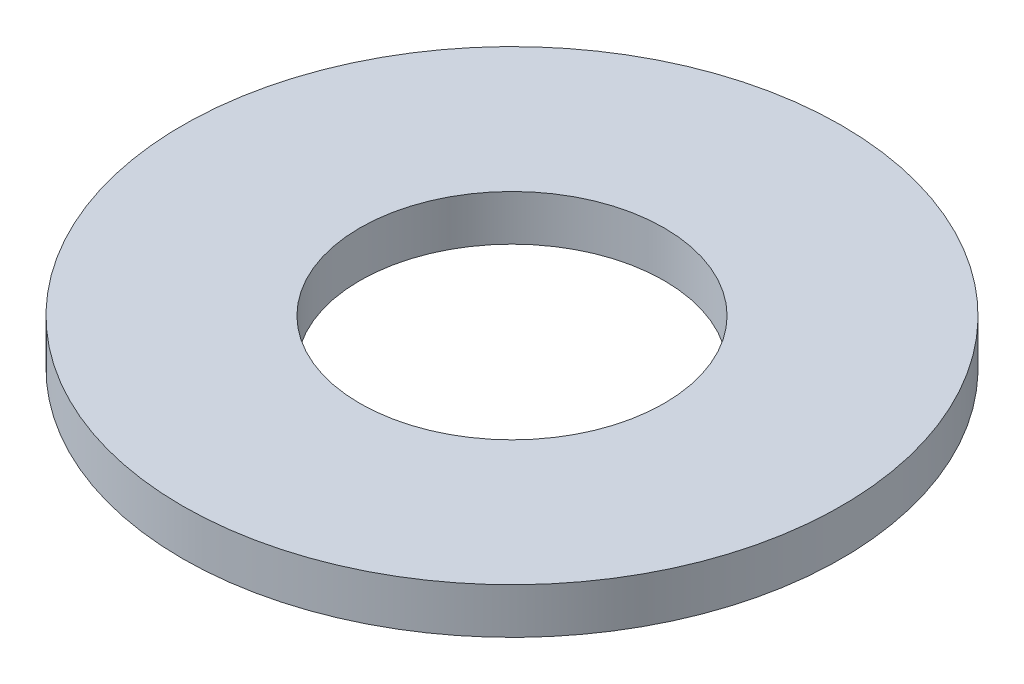
from build123d import *

# Parameters (mm, degrees)
SKETCH1_R           = 65
BOSS_EXTRUDE1_DEPTH = 9
SKETCH2_R           = 30
CUT_EXTRUDE1_DEPTH  = 93.36341267


with BuildPart() as part:
    # Sketch1 → Boss-Extrude1 (new body)
    with BuildSketch(Plane(origin=(0, 0, 0), x_dir=(1, 0, 0), z_dir=(0, 1, 0))):
        Circle(SKETCH1_R)
    extrude(amount=BOSS_EXTRUDE1_DEPTH)

    # Sketch2 → Cut-Extrude1 (cut, through all)
    with BuildSketch(Plane(origin=(0, 0, 0), x_dir=(1, 0, 0), z_dir=(0, 1, 0))):
        Circle(SKETCH2_R)
    extrude(amount=CUT_EXTRUDE1_DEPTH, mode=Mode.SUBTRACT)


solid = part.part
